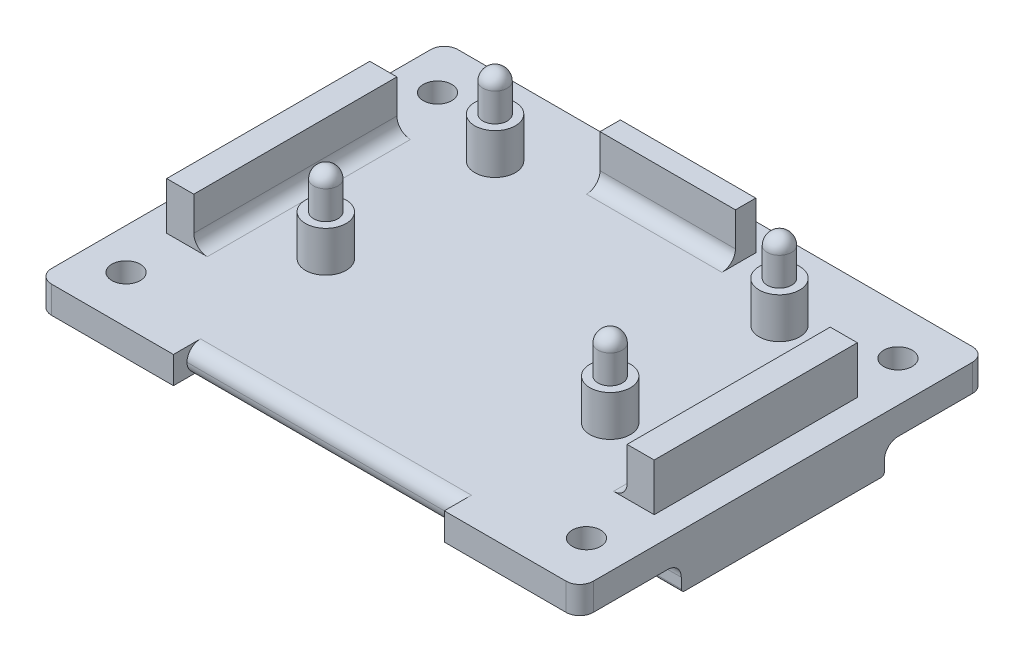
from build123d import *

# Parameters (mm, degrees)
SKETCH3_W               = 40
SKETCH3_H               = 30
BOSS_EXTRUDE1_DEPTH     = 2
SKETCH4_R               = 1.5
BOSS_EXTRUDE2_DEPTH     = 3
FILLET1_R               = 1
SKETCH8_W               = 20
SKETCH8_H               = 1
CUT_EXTRUDE2_DEPTH      = 2
FILLET3_R               = 1
SKETCH9_R               = 0.9
BOSS_EXTRUDE5_DEPTH     = 3
LPATTERN3_COUNT         = 2
LPATTERN3_PITCH         = 21
LPATTERN3_COUNT_DIR2    = 2
LPATTERN3_PITCH_DIR2    = 12.5
FILLET4_R               = 0.9
FILLET5_R               = 1
SKETCH11_R              = 1.05
CUT_EXTRUDE3_DEPTH      = 26.709920264
LPATTERN4_COUNT         = 2
LPATTERN4_PITCH         = 23
LPATTERN4_COUNT_DIR2    = 2
LPATTERN4_PITCH_DIR2    = 34
SKETCH12_W              = 40
SKETCH12_H              = 2.5
BOSS_EXTRUDE7_DEPTH     = 10
SKETCH13_R              = 2
CUT_EXTRUDE4_DEPTH      = 10
SKETCH14_W              = 2
SKETCH14_H              = 15
SKETCH14_W_2            = 10
SKETCH14_H_2            = 1.5
BOSS_EXTRUDE8_DEPTH     = 3.5
FILLET6_R               = 1
CUT_EXTRUDE5_DEPTH      = 44.874821937
CUT_EXTRUDE5_DEPTH_BACK = 44.874821937
SKETCH15_W              = 33.433671885
SKETCH15_H              = 17.879130682
SKETCH16_W              = 40
SKETCH16_H              = 15
BOSS_EXTRUDE9_DEPTH     = 2
FILLET8_R               = 1
FILLET9_R               = 1
FILLET10_R              = 0.25


with BuildPart() as part:
    # Sketch3 → Boss-Extrude1 (new body)
    with BuildSketch(Plane(origin=(0, 0, 0), x_dir=(1, 0, 0), z_dir=(0, 1, 0))):
        Rectangle(SKETCH3_W, SKETCH3_H)
    extrude(amount=BOSS_EXTRUDE1_DEPTH)

    # Sketch4 → Boss-Extrude2 (add)
    with BuildSketch(Plane(origin=(0, 2, 0), x_dir=(1, 0, 0), z_dir=(0, 1, 0))):
        with Locations(Location((-10.5, 9.25, 0), (0, 0, 270))):
            Circle(SKETCH4_R)
        with Locations(Location((10.5, 9.25, 0), (0, 0, 270))):
            Circle(SKETCH4_R)
        with Locations(Location((10.5, -3.25, 0), (0, 0, 270))):
            Circle(SKETCH4_R)
        with Locations(Location((-10.5, -3.25, 0), (0, 0, 270))):
            Circle(SKETCH4_R)
    extrude(amount=BOSS_EXTRUDE2_DEPTH)

    # Fillet1
    fillet1_edges = [part.edges().sort_by_distance(p)[0] for p in [
        (-20, 1, -15),
        (20, 1, -15),
    ]]
    fillet(fillet1_edges, radius=FILLET1_R)

    # Sketch8 → Cut-Extrude2 (cut)
    with BuildSketch(Plane(origin=(0, 2, 0), x_dir=(1, 0, 0), z_dir=(0, 1, 0))):
        with Locations((0, -14.5)):
            Rectangle(SKETCH8_W, SKETCH8_H)
    extrude(amount=-CUT_EXTRUDE2_DEPTH, mode=Mode.SUBTRACT)

    # Fillet3
    fillet3_edges = [part.edges().sort_by_distance(p)[0] for p in [
        (0, 0, 14),
        (0, 2, 14),
    ]]
    fillet(fillet3_edges, radius=FILLET3_R - 0.0001)  # a hair under: the kernel refuses the full size

    # Sketch9 → Boss-Extrude5 (add)
    with BuildSketch(Plane(origin=(0, 5, 0), x_dir=(1, 0, 0), z_dir=(0, 1, 0))):
        with Locations(Location((-10.5, 9.25, 0), (0, 0, 270))):
            Circle(SKETCH9_R)
    boss_extrude5 = extrude(amount=BOSS_EXTRUDE5_DEPTH)

    # LPattern3: Boss-Extrude5 2 × 2
    with Locations(*[(i * LPATTERN3_PITCH, 0, j * LPATTERN3_PITCH_DIR2) for i in range(LPATTERN3_COUNT) for j in range(LPATTERN3_COUNT_DIR2) if (i, j) != (0, 0)]):
        add(boss_extrude5)

    # Fillet4
    fillet4_edges = [part.edges().sort_by_distance(p)[0] for p in [
        (-10.5, 8, -10.15),
        (-10.5, 8, 2.35),
        (10.5, 8, -10.15),
        (10.5, 8, 2.35),
    ]]
    fillet(fillet4_edges, radius=FILLET4_R)

    # Fillet5
    fillet5_edges = [part.edges().sort_by_distance(p)[0] for p in [
        (20, 1, 15),
        (-20, 1, 15),
    ]]
    fillet(fillet5_edges, radius=FILLET5_R)

    # Sketch11 → Cut-Extrude3 (cut, through all)
    with BuildSketch(Plane(origin=(0, 2, 0), x_dir=(1, 0, 0), z_dir=(0, 1, 0))):
        with Locations(Location((-17, -11.5, 0), (0, 0, 270))):
            Circle(SKETCH11_R)
    cut_extrude3 = extrude(amount=-CUT_EXTRUDE3_DEPTH, mode=Mode.SUBTRACT)

    # LPattern4: Cut-Extrude3 2 × 2
    with Locations(*[(j * LPATTERN4_PITCH_DIR2, 0, -i * LPATTERN4_PITCH) for i in range(LPATTERN4_COUNT) for j in range(LPATTERN4_COUNT_DIR2) if (i, j) != (0, 0)]):
        add(cut_extrude3, mode=Mode.SUBTRACT)

    # Sketch12 → Boss-Extrude7 (add)
    with BuildSketch(Plane(origin=(0, 0, 0), x_dir=(-1, 0, 0), z_dir=(0, -1, 0))):
        with Locations((0, 2.25)):
            Rectangle(SKETCH12_W, SKETCH12_H)
    extrude(amount=BOSS_EXTRUDE7_DEPTH)

    # Sketch13 → Cut-Extrude4 (cut)
    with BuildSketch(Plane(origin=(0, 0, -3.5), x_dir=(-1, 0, 0), z_dir=(0, 0, -1))):
        with Locations((12, -5)):
            Circle(SKETCH13_R)
        with Locations((0, -5)):
            Circle(SKETCH13_R)
    extrude(amount=-CUT_EXTRUDE4_DEPTH, mode=Mode.SUBTRACT)

    # Sketch14 → Boss-Extrude8 (add)
    with BuildSketch(Plane(origin=(0, 2, 0), x_dir=(1, 0, 0), z_dir=(0, 1, 0))):
        with Locations((-17, 0)):
            Rectangle(SKETCH14_W, SKETCH14_H)
        with Locations((17, 0)):
            Rectangle(SKETCH14_W, SKETCH14_H)
        with Locations((0, 12.25)):
            Rectangle(SKETCH14_W_2, SKETCH14_H_2)
    extrude(amount=BOSS_EXTRUDE8_DEPTH)

    # Fillet6
    fillet6_edges = [part.edges().sort_by_distance(p)[0] for p in [
        (-16, 2, 0),
        (16, 2, 0),
        (0, 2, -11.5),
    ]]
    fillet(fillet6_edges, radius=FILLET6_R)

    # Sketch15 → Cut-Extrude5 (cut, two sides: drawn at the far end of the back side and taken through both)
    with BuildSketch(Plane.ZY.offset(20).offset(-CUT_EXTRUDE5_DEPTH_BACK)):
        with Locations((1.181680204, -8.939565341)):
            Rectangle(SKETCH15_W, SKETCH15_H)
    extrude(amount=CUT_EXTRUDE5_DEPTH + CUT_EXTRUDE5_DEPTH_BACK, mode=Mode.SUBTRACT)

    # Sketch16 → Boss-Extrude9 (add)
    with BuildSketch(Plane.XZ):
        Rectangle(SKETCH16_W, SKETCH16_H)
    extrude(amount=BOSS_EXTRUDE9_DEPTH)

    # Fillet8
    fillet8_edges = [part.edges().sort_by_distance(p)[0] for p in [
        (0, 0, -7.5),
    ]]
    fillet(fillet8_edges, radius=FILLET8_R)

    # Fillet9
    fillet9_edges = [part.edges().sort_by_distance(p)[0] for p in [
        (0, 0, 7.5),
    ]]
    fillet(fillet9_edges, radius=FILLET9_R)

    # Fillet10
    fillet10_edges = [part.edges().sort_by_distance(p)[0] for p in [
        (0, -2, 7.5),
        (0, -2, -7.5),
    ]]
    fillet(fillet10_edges, radius=FILLET10_R)


solid = part.part
